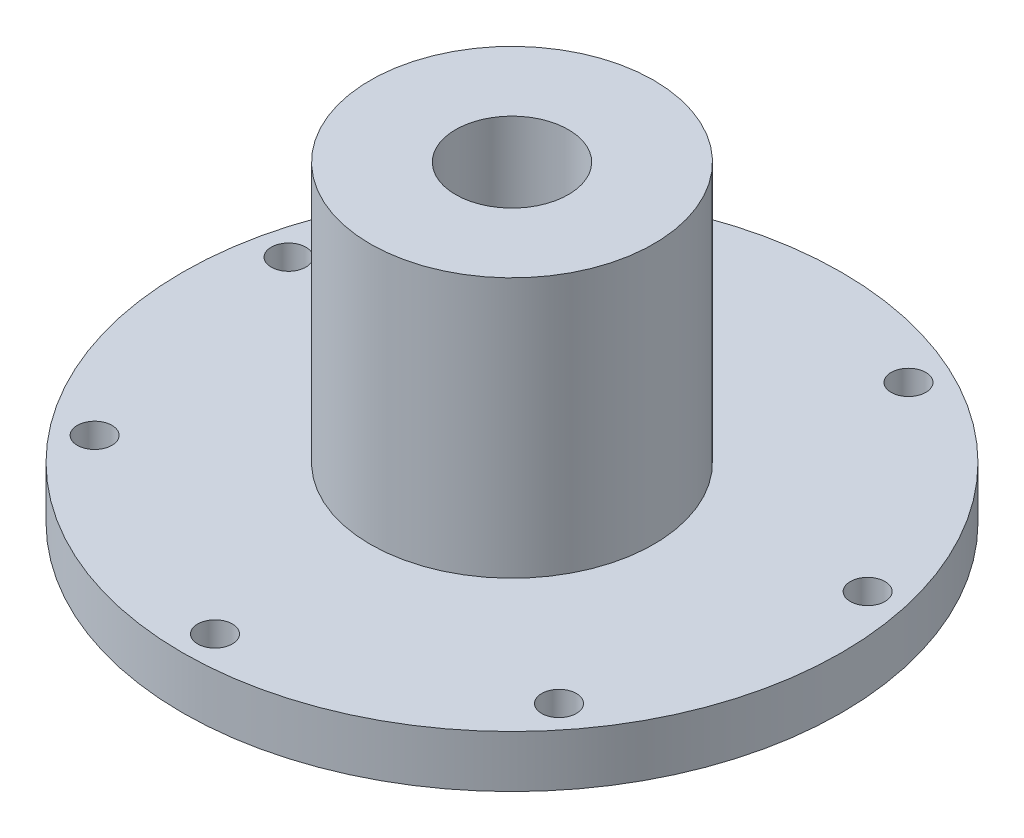
from build123d import *

# Parameters (mm, degrees)
BOSS_EXTRUDE1_DEPTH      = 15
BOSS_EXTRUDE1_DEPTH_BACK = 3
SKETCH1_R                = 8.175
SKETCH1_R_2              = 3.25
SKETCH1_3_R              = 19
SKETCH1_3_R_2            = 8.175
BOSS_EXTRUDE2_DEPTH      = 3
SKETCH2_R                = 2.5
CUT_EXTRUDE1_DEPTH       = 15
CUT_EXTRUDE2_DEPTH       = 33.341923313
CUT_EXTRUDE2_DEPTH_BACK  = 33.341923313
SKETCH3_R                = 1
SKETCH4_R                = 4.175
BOSS_EXTRUDE4_DEPTH      = 10
CUT_EXTRUDE3_DEPTH       = 15
CUT_EXTRUDE3_DEPTH_BACK  = 13
SKETCH1_5_R              = 3.25


with BuildPart() as part:
    # Sketch1 → Boss-Extrude1 (new, two sides: drawn at the far end of the back side and taken through both)
    with BuildSketch(Plane(origin=(0, 0, 0), x_dir=(1, 0, 0), z_dir=(0, 1, 0)).offset(-BOSS_EXTRUDE1_DEPTH_BACK)):
        Circle(SKETCH1_R)
        Circle(SKETCH1_R_2, mode=Mode.SUBTRACT)
    extrude(amount=BOSS_EXTRUDE1_DEPTH + BOSS_EXTRUDE1_DEPTH_BACK)

    # Sketch2 → Cut-Extrude1 (cut)
    with BuildSketch(Plane(origin=(0, 0, 0), x_dir=(0, 0, -1), z_dir=(1, 0, 0))):
        with Locations((0, 6.702870317)):
            Circle(SKETCH2_R)
    extrude(amount=-CUT_EXTRUDE1_DEPTH, mode=Mode.SUBTRACT)



with BuildPart() as body_2:
    # Sketch1<3> → Boss-Extrude2 (new body)
    with BuildSketch(Plane(origin=(0, 0, 0), x_dir=(1, 0, 0), z_dir=(0, 1, 0))):
        Circle(SKETCH1_3_R)
        Circle(SKETCH1_3_R_2, mode=Mode.SUBTRACT)
    extrude(amount=-BOSS_EXTRUDE2_DEPTH)

    # Sketch3 → Cut-Extrude2 (cut, two sides: drawn at the far end of the back side and taken through both)
    with BuildSketch(Plane.XZ.offset(3).offset(-CUT_EXTRUDE2_DEPTH_BACK)):
        with Locations((0, 17.125481179)):
            Circle(SKETCH3_R)
        with Locations((13.389240338, 10.677562867)):
            Circle(SKETCH3_R)
        with Locations((16.696109611, -3.810778066)):
            Circle(SKETCH3_R)
        with Locations((7.430467808, -15.42952539)):
            Circle(SKETCH3_R)
        with Locations((-7.430467808, -15.42952539)):
            Circle(SKETCH3_R)
        with Locations((-16.696109611, -3.810778066)):
            Circle(SKETCH3_R)
        with Locations((-13.389240338, 10.677562867)):
            Circle(SKETCH3_R)
    extrude(amount=CUT_EXTRUDE2_DEPTH + CUT_EXTRUDE2_DEPTH_BACK, mode=Mode.SUBTRACT)


with BuildPart() as part_1:
    add(part.part)

    add(body_2.part)  # Boss-Extrude4 merges body 2
    # Sketch4 → Boss-Extrude4 (add)
    with BuildSketch(Plane.XZ.offset(3)):
        Circle(SKETCH4_R)
    extrude(amount=BOSS_EXTRUDE4_DEPTH)

    # Sketch1<5> → Cut-Extrude3 (cut, two sides: drawn at the far end of the back side and taken through both)
    with BuildSketch(Plane(origin=(0, 0, 0), x_dir=(1, 0, 0), z_dir=(0, 1, 0)).offset(-CUT_EXTRUDE3_DEPTH_BACK)):
        Circle(SKETCH1_5_R)
    extrude(amount=CUT_EXTRUDE3_DEPTH + CUT_EXTRUDE3_DEPTH_BACK, mode=Mode.SUBTRACT)


solid = part_1.part
